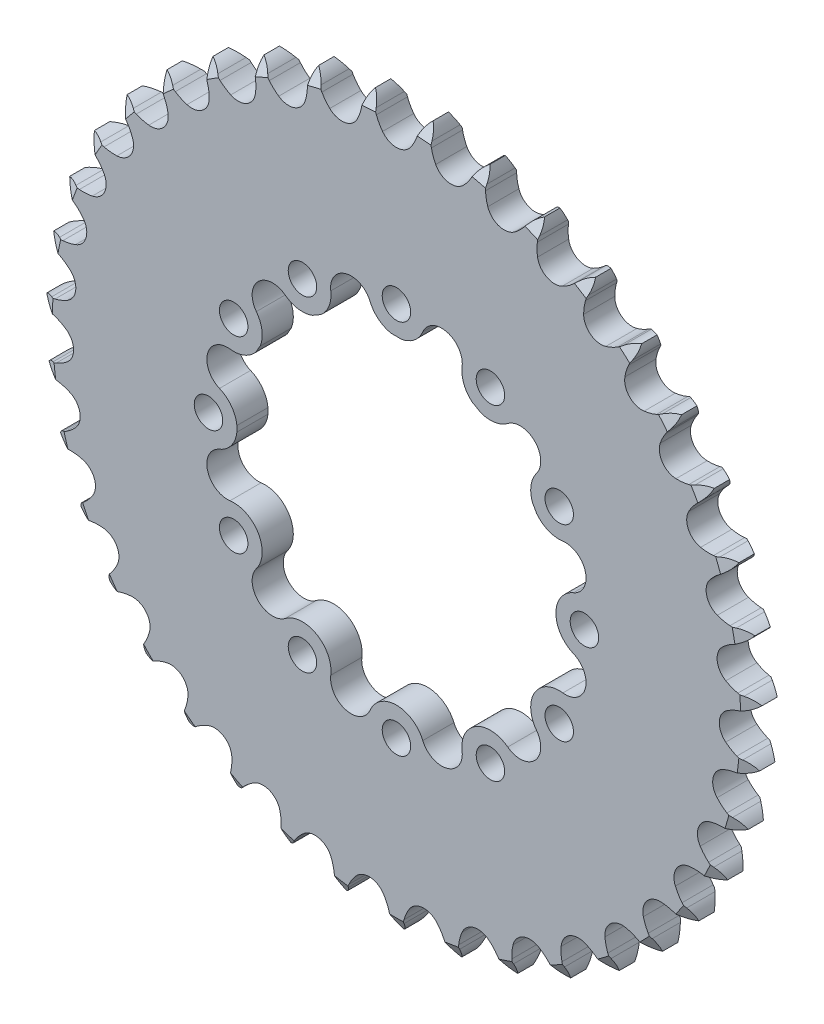
from build123d import *

# Parameters (mm, degrees)
EXTRUSION_DEPTH          = 7.2136
CIRPATTERN1_COUNT        = 12
CUT_EXTRUDE1_DEPTH       = 118.514389318
CUT_EXTRUDE1_DEPTH_BACK  = 118.514389318
SKETCH8_R                = 37
CENTER_CUTOUT_DEPTH      = 118.514389465
CENTER_CUTOUT_DEPTH_BACK = 118.514389465


with BuildPart() as part:
    # Teeth Sketch → Extrusion (new body)
    with BuildSketch(Plane.XY):
        with BuildLine():
            ThreePointArc((6.676484762, 82.703103732), (5.710873677, 81.555589606), (5.037571935, 80.215493266))
            Line((5.037571935, 80.215493266), (4.65053543, 79.150636707))
            ThreePointArc((4.65053543, 79.150636707), (4.030589042, 77.787636082), (3.22092759, 76.5280518))
            ThreePointArc((3.22092759, 76.5280518), (0, 74.905926143), (-3.22092759, 76.5280518))
            ThreePointArc((-3.22092759, 76.5280518), (-4.030589042, 77.787636082), (-4.65053543, 79.150636707))
            Line((-4.65053543, 79.150636707), (-5.037571935, 80.215493266))
            ThreePointArc((-5.037571935, 80.215493266), (-5.710873677, 81.555589606), (-6.676484762, 82.703103732))
            ThreePointArc((-6.676484762, 82.703103732), (-7.445517227, 81.415554702), (-7.895133318, 79.984807062))
            Line((-7.895133318, 79.984807062), (-8.106342797, 78.871655094))
            ThreePointArc((-8.106342797, 78.871655094), (-8.499620367, 77.426858575), (-9.096745387, 76.053706749))
            ThreePointArc((-9.096745387, 76.053706749), (-12.015755556, 73.935914073), (-15.455180235, 75.020360508))
            ThreePointArc((-15.455180235, 75.020360508), (-16.456408311, 76.133754674), (-17.286967233, 77.379658404))
            Line((-17.286967233, 77.379658404), (-17.83980672, 78.368640329))
            ThreePointArc((-17.83980672, 78.368640329), (-18.719355953, 79.583377579), (-19.856536839, 80.561136787))
            ThreePointArc((-19.856536839, 80.561136787), (-20.409073146, 79.166899696), (-20.623358765, 77.682556369))
            Line((-20.623358765, 77.682556369), (-20.653271004, 76.549939044))
            ThreePointArc((-20.653271004, 76.549939044), (-20.809694072, 75.060766102), (-21.178817437, 73.609610642))
            ThreePointArc((-21.178817437, 73.609610642), (-23.720309356, 71.051000665), (-27.289151829, 71.569681286))
            ThreePointArc((-27.289151829, 71.569681286), (-28.456015249, 72.508049011), (-29.475675664, 73.604587595))
            Line((-29.475675664, 73.604587595), (-30.179999883, 74.492080773))
            ThreePointArc((-30.179999883, 74.492080773), (-31.243016742, 75.549997876), (-32.522315041, 76.332678717))
            ThreePointArc((-32.522315041, 76.332678717), (-32.844044791, 74.867863573), (-32.817450053, 73.368368272))
            Line((-32.817450053, 73.368368272), (-32.66529034, 72.245619783))
            ThreePointArc((-32.66529034, 72.245619783), (-32.580807632, 70.750639215), (-32.71236924, 69.259064285))
            ThreePointArc((-32.71236924, 69.259064285), (-34.810519602, 66.325903661), (-38.416348726, 66.265384911))
            ThreePointArc((-38.416348726, 66.265384911), (-39.71862634, 67.004422965), (-40.900979579, 67.923196629))
            Line((-40.900979579, 67.923196629), (-41.738546902, 68.686215454))
            ThreePointArc((-41.738546902, 68.686215454), (-42.957499809, 69.559912912), (-44.345782367, 70.127244363))
            ThreePointArc((-44.345782367, 70.127244363), (-44.428372928, 68.629789109), (-44.161586623, 67.153977974))
            Line((-44.161586623, 67.153977974), (-43.831295815, 66.070176918))
            ThreePointArc((-43.831295815, 66.070176918), (-43.508095388, 64.608107935), (-43.398687863, 63.114744543))
            ThreePointArc((-43.398687863, 63.114744543), (-44.999155676, 59.883000591), (-48.54858237, 59.244849876))
            ThreePointArc((-48.54858237, 59.244849876), (-49.952545871, 59.765417561), (-51.266969607, 60.48263055))
            Line((-51.266969607, 60.48263055), (-52.21608748, 61.101413234))
            ThreePointArc((-52.21608748, 61.101413234), (-53.559406195, 61.768262742), (-55.020717224, 62.105551216))
            ThreePointArc((-55.020717224, 62.105551216), (-54.862029543, 60.614239157), (-54.361961296, 59.200334922))
            Line((-54.361961296, 59.200334922), (-53.862093752, 58.183551176))
            ThreePointArc((-53.862093752, 58.183551176), (-53.308546327, 56.792260597), (-52.961003266, 55.335786069))
            ThreePointArc((-52.961003266, 55.335786069), (-54.022337255, 51.889159262), (-57.423433231, 50.689904348))
            ThreePointArc((-57.423433231, 50.689904348), (-58.892720703, 50.978519235), (-60.305172051, 51.475596109))
            Line((-60.305172051, 51.475596109), (-61.34125882, 51.934116506))
            ThreePointArc((-61.34125882, 51.934116506), (-62.774152094, 52.376847013), (-64.270644405, 52.475356916))
            ThreePointArc((-64.270644405, 52.475356916), (-63.87478841, 51.02881225), (-63.154389727, 49.713434291))
            Line((-63.154389727, 49.713434291), (-62.497891753, 48.790002021))
            ThreePointArc((-62.497891753, 48.790002021), (-61.728333918, 47.505523541), (-61.151656504, 46.123659804))
            ThreePointArc((-61.151656504, 46.123659804), (-61.646368676, 42.551415963), (-64.811047336, 40.822116924))
            ThreePointArc((-64.811047336, 40.822116924), (-66.307605004, 40.871304038), (-67.781502216, 41.135370767))
            Line((-67.781502216, 41.135370767), (-68.877723777, 41.42175344))
            ThreePointArc((-68.877723777, 41.42175344), (-70.363080428, 41.628898458), (-71.855995657, 41.486078435))
            ThreePointArc((-71.855995657, 41.486078435), (-71.23322381, 40.12176591), (-70.311152637, 38.938981826))
            Line((-70.311152637, 38.938981826), (-69.515027187, 38.132817442))
            ThreePointArc((-69.515027187, 38.132817442), (-68.549390085, 36.988418379), (-67.75851396, 35.716954977))
            ThreePointArc((-67.75851396, 35.716954977), (-67.673791529, 32.111613343), (-70.520089358, 29.897058114))
            ThreePointArc((-70.520089358, 29.897058114), (-72.005157166, 29.705543536), (-73.502327078, 29.729760931))
            Line((-73.502327078, 29.729760931), (-74.630291869, 29.836588719))
            ThreePointArc((-74.630291869, 29.836588719), (-76.129641939, 29.8027833), (-77.580314364, 29.422332315))
            ThreePointArc((-77.580314364, 29.422332315), (-76.74675613, 28.175586908), (-75.646893627, 27.156030185))
            Line((-75.646893627, 27.156030185), (-74.731759931, 26.488012922))
            ThreePointArc((-74.731759931, 26.488012922), (-73.595053056, 25.51333261), (-72.610461496, 24.385199777))
            ThreePointArc((-72.610461496, 24.385199777), (-71.948498729, 20.840136804), (-74.402698108, 18.197681204))
            ThreePointArc((-74.402698108, 18.197681204), (-75.837813579, 17.77042506), (-77.319480277, 17.554165902))
            Line((-77.319480277, 17.554165902), (-78.449974603, 17.478672021))
            ThreePointArc((-78.449974603, 17.478672021), (-79.924485713, 17.204791709), (-81.295343681, 16.596563242))
            ThreePointArc((-81.295343681, 16.596563242), (-80.27258778, 15.499675005), (-79.023419807, 14.669751627))
            Line((-79.023419807, 14.669751627), (-78.012979347, 14.15718278))
            ThreePointArc((-78.012979347, 14.15718278), (-76.734642811, 13.377464928), (-75.58183622, 12.421880712))
            ThreePointArc((-75.58183622, 12.421880712), (-74.359777605, 9.028911669), (-76.358316059, 6.026993909))
            ThreePointArc((-76.358316059, 6.026993909), (-77.706310456, 5.375061909), (-79.134099551, 4.923927198))
            Line((-79.134099551, 4.923927198), (-80.237844202, 4.6680669))
            ThreePointArc((-80.237844202, 4.6680669), (-81.649327289, 4.161205049), (-82.904866299, 3.340951899))
            ThreePointArc((-82.904866299, 3.340951899), (-81.719401571, 2.422329661), (-80.353280924, 1.803534207))
            Line((-80.353280924, 1.803534207), (-79.273703577, 1.45968904))
            ThreePointArc((-79.273703577, 1.45968904), (-77.886845624, 0.895127931), (-76.595681088, 0.136841462))
            ThreePointArc((-76.595681088, 0.136841462), (-74.8451773, -3.016157536), (-76.336293733, -6.299789363))
            ThreePointArc((-76.336293733, -6.299789363), (-77.56225471, -7.159512522), (-78.899187214, -7.833838635))
            Line((-78.899187214, -7.833838635), (-79.947595784, -8.263438702))
            ThreePointArc((-79.947595784, -8.263438702), (-81.259494176, -8.990154635), (-82.367196428, -10.001188343))
            ThreePointArc((-82.367196428, -10.001188343), (-81.049725787, -10.717752749), (-79.602034272, -11.109393802))
            Line((-79.602034272, -11.109393802), (-78.481280524, -11.275609878))
            ThreePointArc((-78.481280524, -11.275609878), (-77.021820047, -11.610392409), (-75.625738049, -12.151741911))
            ThreePointArc((-75.625738049, -12.151741911), (-73.392126218, -14.983109845), (-74.337201497, -18.463411399))
            ThreePointArc((-74.337201497, -18.463411399), (-75.409377308, -19.50865934), (-76.620827372, -20.388712162))
            Line((-76.620827372, -20.388712162), (-77.586746629, -20.980925582))
            ThreePointArc((-77.586746629, -20.980925582), (-78.765082849, -21.908674036), (-79.696259435, -23.08430306))
            ThreePointArc((-79.696259435, -23.08430306), (-78.280904679, -23.580250992), (-76.789136745, -23.734594346))
            Line((-76.789136745, -23.734594346), (-75.656233531, -23.718876424))
            ThreePointArc((-75.656233531, -23.718876424), (-74.161969788, -23.815209685), (-72.697128119, -24.125601551))
            ThreePointArc((-72.697128119, -24.125601551), (-70.038257617, -26.562007479), (-70.41281479, -30.148840778))
            ThreePointArc((-70.41281479, -30.148840778), (-71.303436645, -31.352542128), (-72.358028349, -32.415528753))
            Line((-72.358028349, -32.415528753), (-73.216441492, -33.155017511))
            ThreePointArc((-73.216441492, -33.155017511), (-74.230697248, -34.259770288), (-74.961231185, -35.569546454))
            ThreePointArc((-74.961231185, -35.569546454), (-73.484649258, -35.832033121), (-71.987440912, -35.745081364))
            Line((-71.987440912, -35.745081364), (-70.871729829, -35.547836529))
            ThreePointArc((-70.871729829, -35.547836529), (-69.381363468, -35.403225539), (-67.885700756, -35.474620783))
            ThreePointArc((-67.885700756, -35.474620783), (-64.870434934, -37.452963072), (-64.664773166, -41.053431017))
            ThreePointArc((-64.664773166, -41.053431017), (-65.350774426, -42.384410543), (-66.221194398, -43.602800177))
            Line((-66.221194398, -43.602800177), (-66.949868978, -44.470411902))
            ThreePointArc((-66.949868978, -44.470411902), (-67.773775581, -45.723556485), (-68.284746423, -47.133557278))
            ThreePointArc((-68.284746423, -47.133557278), (-66.785180021, -47.155784414), (-65.321308173, -46.829789551))
            Line((-65.321308173, -46.829789551), (-64.251685552, -46.456126341))
            ThreePointArc((-64.251685552, -46.456126341), (-62.803816278, -46.074316448), (-61.316069403, -45.904865971))
            ThreePointArc((-61.316069403, -45.904865971), (-58.022502061, -47.373906594), (-57.241947884, -50.894758957))
            ThreePointArc((-57.241947884, -50.894758957), (-57.705561477, -52.318544989), (-58.369266298, -53.66078198))
            Line((-58.369266298, -53.66078198), (-58.949330025, -54.634045983))
            ThreePointArc((-58.949330025, -54.634045983), (-59.561548726, -56.003126587), (-59.839722596, -57.476833727))
            ThreePointArc((-59.839722596, -57.476833727), (-58.356009703, -57.25822566), (-56.963387864, -56.701630787))
            Line((-56.963387864, -56.701630787), (-55.967556369, -56.161226883))
            ThreePointArc((-55.967556369, -56.161226883), (-54.599683236, -55.552106762), (-53.15838406, -55.146199243))
            ThreePointArc((-53.15838406, -55.146199243), (-49.671816862, -56.06789082), (-48.336586219, -59.417939375))
            ThreePointArc((-48.336586219, -59.417939375), (-48.565804798, -60.897656602), (-49.00560486, -62.328977716))
            Line((-49.00560486, -62.328977716), (-49.422034389, -63.382686971))
            ThreePointArc((-49.422034389, -63.382686971), (-49.806709045, -64.832245127), (-49.844881387, -66.331490374))
            ThreePointArc((-49.844881387, -66.331490374), (-48.415449386, -65.877708938), (-47.130145731, -65.104929569))
            Line((-47.130145731, -65.104929569), (-46.233896874, -64.411781148))
            ThreePointArc((-46.233896874, -64.411781148), (-44.981447078, -63.591126692), (-43.623924493, -62.959274922))
            ThreePointArc((-43.623924493, -62.959274922), (-40.034657698, -63.309746125), (-38.179332362, -66.402226373))
            ThreePointArc((-38.179332362, -66.402226373), (-38.168219284, -67.899550896), (-38.372723998, -69.38288567))
            Line((-38.372723998, -69.38288567), (-38.614734022, -70.489749661))
            ThreePointArc((-38.614734022, -70.489749661), (-38.761901763, -71.982242573), (-38.559083932, -73.468196262))
            ThreePointArc((-38.559083932, -73.468196262), (-37.220954361, -72.790994159), (-36.076257579, -71.822044874))
            Line((-36.076257579, -71.822044874), (-35.302803736, -70.994104116))
            ThreePointArc((-35.302803736, -70.994104116), (-34.198215068, -69.983169844), (-32.959628196, -69.141738451))
            ThreePointArc((-32.959628196, -69.141738451), (-29.360621929, -68.91191226), (-27.033253851, -71.666730588))
            ThreePointArc((-27.033253851, -71.666730588), (-26.78209694, -73.142882488), (-26.74600974, -74.639813329))
            Line((-26.74600974, -74.639813329), (-26.807332328, -75.77116486))
            ThreePointArc((-26.807332328, -75.77116486), (-26.713181585, -77.267937748), (-26.274626458, -78.702114459))
            ThreePointArc((-26.274626458, -78.702114459), (-25.06245617, -77.819030866), (-24.088013307, -76.679006943))
            Line((-24.088013307, -76.679006943), (-23.457386525, -75.737717079))
            ThreePointArc((-23.457386525, -75.737717079), (-22.529267252, -74.562685657), (-21.441694841, -73.533467273))
            ThreePointArc((-21.441694841, -73.533467273), (-17.926161474, -72.729296065), (-15.187028265, -75.075104125))
            ThreePointArc((-15.187028265, -75.075104125), (-14.702332353, -76.491851845), (-14.426587879, -77.96360903))
            Line((-14.426587879, -77.96360903), (-14.305634807, -79.090146691))
            ThreePointArc((-14.305634807, -79.090146691), (-13.972604036, -80.552433921), (-13.309669959, -81.897689231))
            ThreePointArc((-13.309669959, -81.897689231), (-12.254853529, -80.83159555), (-11.475902142, -79.55002301))
            Line((-11.475902142, -79.55002301), (-11.004435324, -78.519762952))
            ThreePointArc((-11.004435324, -78.519762952), (-10.276823247, -77.211067077), (-9.368432854, -76.020717918))
            ThreePointArc((-9.368432854, -76.020717918), (-6.027422853, -74.663029306), (-2.947466624, -76.5390719))
            ThreePointArc((-2.947466624, -76.5390719), (-2.241785081, -77.859722417), (-1.733524971, -79.26818821))
            Line((-1.733524971, -79.26818821), (-1.43342886, -80.360735266))
            ThreePointArc((-1.43342886, -80.360735266), (-0.870143382, -81.750664368), (0, -82.97215687))
            ThreePointArc((0, -82.97215687), (0.870143382, -81.750664368), (1.43342886, -80.360735266))
            Line((1.43342886, -80.360735266), (1.733524971, -79.26818821))
            ThreePointArc((1.733524971, -79.26818821), (2.241785081, -77.859722417), (2.947466624, -76.5390719))
            ThreePointArc((2.947466624, -76.5390719), (6.027422853, -74.663029306), (9.368432854, -76.020717918))
            ThreePointArc((9.368432854, -76.020717918), (10.276823247, -77.211067077), (11.004435324, -78.519762952))
            Line((11.004435324, -78.519762952), (11.475902142, -79.55002301))
            ThreePointArc((11.475902142, -79.55002301), (12.254853529, -80.83159555), (13.309669959, -81.897689231))
            ThreePointArc((13.309669959, -81.897689231), (13.972604036, -80.552433921), (14.305634807, -79.090146691))
            Line((14.305634807, -79.090146691), (14.426587879, -77.96360903))
            ThreePointArc((14.426587879, -77.96360903), (14.702332353, -76.491851845), (15.187028265, -75.075104125))
            ThreePointArc((15.187028265, -75.075104125), (17.926161474, -72.729296065), (21.441694841, -73.533467273))
            ThreePointArc((21.441694841, -73.533467273), (22.529267252, -74.562685657), (23.457386525, -75.737717079))
            Line((23.457386525, -75.737717079), (24.088013307, -76.679006943))
            ThreePointArc((24.088013307, -76.679006943), (25.06245617, -77.819030866), (26.274626458, -78.702114459))
            ThreePointArc((26.274626458, -78.702114459), (26.713181585, -77.267937748), (26.807332328, -75.77116486))
            Line((26.807332328, -75.77116486), (26.74600974, -74.639813329))
            ThreePointArc((26.74600974, -74.639813329), (26.78209694, -73.142882488), (27.033253851, -71.666730588))
            ThreePointArc((27.033253851, -71.666730588), (29.360621929, -68.91191226), (32.959628196, -69.141738451))
            ThreePointArc((32.959628196, -69.141738451), (34.198215068, -69.983169844), (35.302803736, -70.994104116))
            Line((35.302803736, -70.994104116), (36.076257579, -71.822044874))
            ThreePointArc((36.076257579, -71.822044874), (37.220954361, -72.790994159), (38.559083932, -73.468196262))
            ThreePointArc((38.559083932, -73.468196262), (38.761901763, -71.982242573), (38.614734022, -70.489749661))
            Line((38.614734022, -70.489749661), (38.372723998, -69.38288567))
            ThreePointArc((38.372723998, -69.38288567), (38.168219284, -67.899550896), (38.179332362, -66.402226373))
            ThreePointArc((38.179332362, -66.402226373), (40.034657698, -63.309746125), (43.623924493, -62.959274922))
            ThreePointArc((43.623924493, -62.959274922), (44.981447078, -63.591126692), (46.233896874, -64.411781148))
            Line((46.233896874, -64.411781148), (47.130145731, -65.104929569))
            ThreePointArc((47.130145731, -65.104929569), (48.415449386, -65.877708938), (49.844881387, -66.331490374))
            ThreePointArc((49.844881387, -66.331490374), (49.806709045, -64.832245127), (49.422034389, -63.382686971))
            Line((49.422034389, -63.382686971), (49.00560486, -62.328977716))
            ThreePointArc((49.00560486, -62.328977716), (48.565804798, -60.897656602), (48.336586219, -59.417939375))
            ThreePointArc((48.336586219, -59.417939375), (49.671816862, -56.06789082), (53.15838406, -55.146199243))
            ThreePointArc((53.15838406, -55.146199243), (54.599683236, -55.552106762), (55.967556369, -56.161226883))
            Line((55.967556369, -56.161226883), (56.963387864, -56.701630787))
            ThreePointArc((56.963387864, -56.701630787), (58.356009703, -57.25822566), (59.839722596, -57.476833727))
            ThreePointArc((59.839722596, -57.476833727), (59.561548726, -56.003126587), (58.949330025, -54.634045983))
            Line((58.949330025, -54.634045983), (58.369266298, -53.66078198))
            ThreePointArc((58.369266298, -53.66078198), (57.705561477, -52.318544989), (57.241947884, -50.894758957))
            ThreePointArc((57.241947884, -50.894758957), (58.022502061, -47.373906594), (61.316069403, -45.904865971))
            ThreePointArc((61.316069403, -45.904865971), (62.803816278, -46.074316448), (64.251685552, -46.456126341))
            Line((64.251685552, -46.456126341), (65.321308173, -46.829789551))
            ThreePointArc((65.321308173, -46.829789551), (66.785180021, -47.155784414), (68.284746423, -47.133557278))
            ThreePointArc((68.284746423, -47.133557278), (67.773775581, -45.723556485), (66.949868978, -44.470411902))
            Line((66.949868978, -44.470411902), (66.221194398, -43.602800177))
            ThreePointArc((66.221194398, -43.602800177), (65.350774426, -42.384410543), (64.664773166, -41.053431017))
            ThreePointArc((64.664773166, -41.053431017), (64.870434934, -37.452963072), (67.885700756, -35.474620783))
            ThreePointArc((67.885700756, -35.474620783), (69.381363468, -35.403225539), (70.871729829, -35.547836529))
            Line((70.871729829, -35.547836529), (71.987440912, -35.745081364))
            ThreePointArc((71.987440912, -35.745081364), (73.484649258, -35.832033121), (74.961231185, -35.569546454))
            ThreePointArc((74.961231185, -35.569546454), (74.230697248, -34.259770288), (73.216441492, -33.155017511))
            Line((73.216441492, -33.155017511), (72.358028349, -32.415528753))
            ThreePointArc((72.358028349, -32.415528753), (71.303436645, -31.352542128), (70.41281479, -30.148840778))
            ThreePointArc((70.41281479, -30.148840778), (70.038257617, -26.562007479), (72.697128119, -24.125601551))
            ThreePointArc((72.697128119, -24.125601551), (74.161969788, -23.815209685), (75.656233531, -23.718876424))
            Line((75.656233531, -23.718876424), (76.789136745, -23.734594346))
            ThreePointArc((76.789136745, -23.734594346), (78.280904679, -23.580250992), (79.696259435, -23.08430306))
            ThreePointArc((79.696259435, -23.08430306), (78.765082849, -21.908674036), (77.586746629, -20.980925582))
            Line((77.586746629, -20.980925582), (76.620827372, -20.388712162))
            ThreePointArc((76.620827372, -20.388712162), (75.409377308, -19.50865934), (74.337201497, -18.463411399))
            ThreePointArc((74.337201497, -18.463411399), (73.392126218, -14.983109845), (75.625738049, -12.151741911))
            ThreePointArc((75.625738049, -12.151741911), (77.021820047, -11.610392409), (78.481280524, -11.275609878))
            Line((78.481280524, -11.275609878), (79.602034272, -11.109393802))
            ThreePointArc((79.602034272, -11.109393802), (81.049725787, -10.717752749), (82.367196428, -10.001188343))
            ThreePointArc((82.367196428, -10.001188343), (81.259494176, -8.990154635), (79.947595784, -8.263438702))
            Line((79.947595784, -8.263438702), (78.899187214, -7.833838635))
            ThreePointArc((78.899187214, -7.833838635), (77.56225471, -7.159512522), (76.336293733, -6.299789363))
            ThreePointArc((76.336293733, -6.299789363), (74.8451773, -3.016157536), (76.595681088, 0.136841462))
            ThreePointArc((76.595681088, 0.136841462), (77.886845624, 0.895127931), (79.273703577, 1.45968904))
            Line((79.273703577, 1.45968904), (80.353280924, 1.803534207))
            ThreePointArc((80.353280924, 1.803534207), (81.719401571, 2.422329661), (82.904866299, 3.340951899))
            ThreePointArc((82.904866299, 3.340951899), (81.649327289, 4.161205049), (80.237844202, 4.6680669))
            Line((80.237844202, 4.6680669), (79.134099551, 4.923927198))
            ThreePointArc((79.134099551, 4.923927198), (77.706310456, 5.375061909), (76.358316059, 6.026993909))
            ThreePointArc((76.358316059, 6.026993909), (74.359777605, 9.028911669), (75.58183622, 12.421880712))
            ThreePointArc((75.58183622, 12.421880712), (76.734642811, 13.377464928), (78.012979347, 14.15718278))
            Line((78.012979347, 14.15718278), (79.023419807, 14.669751627))
            ThreePointArc((79.023419807, 14.669751627), (80.27258778, 15.499675005), (81.295343681, 16.596563242))
            ThreePointArc((81.295343681, 16.596563242), (79.924485713, 17.204791709), (78.449974603, 17.478672021))
            Line((78.449974603, 17.478672021), (77.319480277, 17.554165902))
            ThreePointArc((77.319480277, 17.554165902), (75.837813579, 17.77042506), (74.402698108, 18.197681204))
            ThreePointArc((74.402698108, 18.197681204), (71.948498729, 20.840136804), (72.610461496, 24.385199777))
            ThreePointArc((72.610461496, 24.385199777), (73.595053056, 25.51333261), (74.731759931, 26.488012922))
            Line((74.731759931, 26.488012922), (75.646893627, 27.156030185))
            ThreePointArc((75.646893627, 27.156030185), (76.74675613, 28.175586908), (77.580314364, 29.422332315))
            ThreePointArc((77.580314364, 29.422332315), (76.129641939, 29.8027833), (74.630291869, 29.836588719))
            Line((74.630291869, 29.836588719), (73.502327078, 29.729760931))
            ThreePointArc((73.502327078, 29.729760931), (72.005157166, 29.705543536), (70.520089358, 29.897058114))
            ThreePointArc((70.520089358, 29.897058114), (67.673791529, 32.111613343), (67.75851396, 35.716954977))
            ThreePointArc((67.75851396, 35.716954977), (68.549390085, 36.988418379), (69.515027187, 38.132817442))
            Line((69.515027187, 38.132817442), (70.311152637, 38.938981826))
            ThreePointArc((70.311152637, 38.938981826), (71.23322381, 40.12176591), (71.855995657, 41.486078435))
            ThreePointArc((71.855995657, 41.486078435), (70.363080428, 41.628898458), (68.877723777, 41.42175344))
            Line((68.877723777, 41.42175344), (67.781502216, 41.135370767))
            ThreePointArc((67.781502216, 41.135370767), (66.307605004, 40.871304038), (64.811047336, 40.822116924))
            ThreePointArc((64.811047336, 40.822116924), (61.646368676, 42.551415963), (61.151656504, 46.123659804))
            ThreePointArc((61.151656504, 46.123659804), (61.728333918, 47.505523541), (62.497891753, 48.790002021))
            Line((62.497891753, 48.790002021), (63.154389727, 49.713434291))
            ThreePointArc((63.154389727, 49.713434291), (63.87478841, 51.02881225), (64.270644405, 52.475356916))
            ThreePointArc((64.270644405, 52.475356916), (62.774152094, 52.376847013), (61.34125882, 51.934116506))
            Line((61.34125882, 51.934116506), (60.305172051, 51.475596109))
            ThreePointArc((60.305172051, 51.475596109), (58.892720703, 50.978519235), (57.423433231, 50.689904348))
            ThreePointArc((57.423433231, 50.689904348), (54.022337255, 51.889159262), (52.961003266, 55.335786069))
            ThreePointArc((52.961003266, 55.335786069), (53.308546327, 56.792260597), (53.862093752, 58.183551176))
            Line((53.862093752, 58.183551176), (54.361961296, 59.200334922))
            ThreePointArc((54.361961296, 59.200334922), (54.862029543, 60.614239157), (55.020717224, 62.105551216))
            ThreePointArc((55.020717224, 62.105551216), (53.559406195, 61.768262742), (52.21608748, 61.101413234))
            Line((52.21608748, 61.101413234), (51.266969607, 60.48263055))
            ThreePointArc((51.266969607, 60.48263055), (49.952545871, 59.765417561), (48.54858237, 59.244849876))
            ThreePointArc((48.54858237, 59.244849876), (44.999155676, 59.883000591), (43.398687863, 63.114744543))
            ThreePointArc((43.398687863, 63.114744543), (43.508095388, 64.608107935), (43.831295815, 66.070176918))
            Line((43.831295815, 66.070176918), (44.161586623, 67.153977974))
            ThreePointArc((44.161586623, 67.153977974), (44.428372928, 68.629789109), (44.345782367, 70.127244363))
            ThreePointArc((44.345782367, 70.127244363), (42.957499809, 69.559912912), (41.738546902, 68.686215454))
            Line((41.738546902, 68.686215454), (40.900979579, 67.923196629))
            ThreePointArc((40.900979579, 67.923196629), (39.71862634, 67.004422965), (38.416348726, 66.265384911))
            ThreePointArc((38.416348726, 66.265384911), (34.810519602, 66.325903661), (32.71236924, 69.259064285))
            ThreePointArc((32.71236924, 69.259064285), (32.580807632, 70.750639215), (32.66529034, 72.245619783))
            Line((32.66529034, 72.245619783), (32.817450053, 73.368368272))
            ThreePointArc((32.817450053, 73.368368272), (32.844044791, 74.867863573), (32.522315041, 76.332678717))
            ThreePointArc((32.522315041, 76.332678717), (31.243016742, 75.549997876), (30.179999883, 74.492080773))
            Line((30.179999883, 74.492080773), (29.475675664, 73.604587595))
            ThreePointArc((29.475675664, 73.604587595), (28.456015249, 72.508049011), (27.289151829, 71.569681286))
            ThreePointArc((27.289151829, 71.569681286), (23.720309356, 71.051000665), (21.178817437, 73.609610642))
            ThreePointArc((21.178817437, 73.609610642), (20.809694072, 75.060766102), (20.653271004, 76.549939044))
            Line((20.653271004, 76.549939044), (20.623358765, 77.682556369))
            ThreePointArc((20.623358765, 77.682556369), (20.409073146, 79.166899696), (19.856536839, 80.561136787))
            ThreePointArc((19.856536839, 80.561136787), (18.719355953, 79.583377579), (17.83980672, 78.368640329))
            Line((17.83980672, 78.368640329), (17.286967233, 77.379658404))
            ThreePointArc((17.286967233, 77.379658404), (16.456408311, 76.133754674), (15.455180235, 75.020360508))
            ThreePointArc((15.455180235, 75.020360508), (12.015755556, 73.935914073), (9.096745387, 76.053706749))
            ThreePointArc((9.096745387, 76.053706749), (8.499620367, 77.426858575), (8.106342797, 78.871655094))
            Line((8.106342797, 78.871655094), (7.895133318, 79.984807062))
            ThreePointArc((7.895133318, 79.984807062), (7.445517227, 81.415554702), (6.676484762, 82.703103732))
        make_face()
    extrude(amount=EXTRUSION_DEPTH)

    # Sketch7 → M6 Clearance Hole1 (revolve, cut)
    with BuildSketch(Plane(origin=(0, 43.500000122, 0), x_dir=(0, 1, 0), z_dir=(1, 0, 0))):
        Polygon((0, 0), (0, 19.254840043), (3.3, 17.272), (3.3, 0), align=None)
    m6_clearance_hole1 = revolve(axis=Axis((0, 43.500000122, -6.35), (0, 0, 1)), mode=Mode.SUBTRACT)

    # CirPattern1: M6 Clearance Hole1 ×12 about axis
    cirpattern1_axis = Axis((0, -0.078817912, 0), (0, 0, 1))
    for i in range(1, CIRPATTERN1_COUNT):
        add(m6_clearance_hole1.rotate(cirpattern1_axis, i * 360 / CIRPATTERN1_COUNT), mode=Mode.SUBTRACT)

    # Sketch8 → Cut-Extrude1 (cut, two sides: drawn at the far end of the back side and taken through both)
    with BuildSketch(Plane(origin=(0, 0, 0), x_dir=(-1, 0, 0), z_dir=(0, 0, -1)).offset(-CUT_EXTRUDE1_DEPTH_BACK)):
        Circle(SKETCH8_R)
    extrude(amount=CUT_EXTRUDE1_DEPTH + CUT_EXTRUDE1_DEPTH_BACK, mode=Mode.SUBTRACT)

    # Sketch5 → Cut-Revolve1 (revolve, cut)
    with BuildSketch(Plane(origin=(0, 0, 0), x_dir=(0, 0, -1), z_dir=(1, 0, 0))):
        Polygon((-7.2136, -79.778574738), (-7.2136, -82.97215687), (-5.3848, -82.97215687), align=None)
    cut_revolve1 = revolve(axis=Axis((0, 0, 7.2136), (0, 0, -1)), mode=Mode.SUBTRACT)

    # Mirror1: Cut-Revolve1 across plane
    add(cut_revolve1.mirror(Plane.XY.offset(3.6068)), mode=Mode.SUBTRACT)

    # Sketch9 → Center Cutout (cut, two sides: drawn at the far end of the back side and taken through both)
    with BuildSketch(Plane.XY.offset(7.2136).offset(-CENTER_CUTOUT_DEPTH_BACK)):
        with BuildLine():
            ThreePointArc((1.148678559, 36.982165128), (0, 36.881719723), (-1.148678559, 36.982165128))
            ThreePointArc((-1.148678559, 36.982165128), (-9.617726785, 35.728130814), (-17.571834052, 32.561183149))
            ThreePointArc((-17.571834052, 32.561183149), (-18.475078878, 31.932946165), (-19.469920872, 31.463028799))
            ThreePointArc((-19.469920872, 31.463028799), (-22.757183287, 31.114405097), (-25.803005362, 32.399162099))
            ThreePointArc((-25.803005362, 32.399162099), (-32.058776499, 31.979958587), (-32.477980012, 25.72418745))
            ThreePointArc((-32.477980012, 25.72418745), (-31.470213373, 23.82881041), (-31.122083086, 21.710591105))
            ThreePointArc((-31.122083086, 21.710591105), (-31.241007029, 20.461591061), (-31.59350497, 19.257477605))
            ThreePointArc((-31.59350497, 19.257477605), (-32.00358372, 18.410440597), (-32.529655862, 17.630130162))
            ThreePointArc((-32.529655862, 17.630130162), (-35.22884515, 15.587363925), (-38.585048144, 15.14643516))
            ThreePointArc((-38.585048144, 15.14643516), (-43.793103112, 11.655508701), (-41.028258435, 6.02825022))
            ThreePointArc((-41.028258435, 6.02825022), (-38.265449818, 3.867034802), (-36.99517654, 0.597421776))
            ThreePointArc((-36.99517654, 0.597421776), (-36.969203034, 0.259745217), (-36.960537635, -0.078817912))
            ThreePointArc((-36.960537635, -0.078817912), (-36.968601511, -0.405426166), (-36.992773486, -0.731238524))
            ThreePointArc((-36.992773486, -0.731238524), (-38.258321936, -4.015054276), (-41.028258435, -6.185886044))
            ThreePointArc((-41.028258435, -6.185886044), (-43.793103112, -11.813144525), (-38.585048144, -15.304070984))
            ThreePointArc((-38.585048144, -15.304070984), (-33.369363855, -16.898720145), (-31.122083086, -21.868226929))
            ThreePointArc((-31.122083086, -21.868226929), (-31.470213373, -23.986446234), (-32.477980012, -25.881823274))
            ThreePointArc((-32.477980012, -25.881823274), (-32.058776499, -32.137594411), (-25.803005362, -32.556797924))
            ThreePointArc((-25.803005362, -32.556797924), (-18.853550589, -31.887708499), (-15.171128618, -37.819181396))
            ThreePointArc((-15.171128618, -37.819181396), (-15.184673592, -38.242389865), (-15.225253072, -38.663866056))
            ThreePointArc((-15.225253072, -38.663866056), (-11.734326613, -43.871921024), (-6.107068132, -41.107076347))
            ThreePointArc((-6.107068132, -41.107076347), (0, -37.039355547), (6.107068132, -41.107076347))
            ThreePointArc((6.107068132, -41.107076347), (11.734326613, -43.871921024), (15.225253072, -38.663866056))
            ThreePointArc((15.225253072, -38.663866056), (18.480268818, -32.087582442), (25.803005362, -32.556797924))
            ThreePointArc((25.803005362, -32.556797924), (32.058776499, -32.137594411), (32.477980012, -25.881823274))
            ThreePointArc((32.477980012, -25.881823274), (31.135298942, -22.286267386), (32.013950026, -18.550121394))
            ThreePointArc((32.013950026, -18.550121394), (35.635096733, -9.956901166), (36.992773486, -0.731238524))
            ThreePointArc((36.992773486, -0.731238524), (36.96054846, -0.066847918), (36.99517654, 0.597421776))
            ThreePointArc((36.99517654, 0.597421776), (35.79041588, 9.383289996), (32.529655862, 17.630130162))
            ThreePointArc((32.529655862, 17.630130162), (32.00358372, 18.410440597), (31.59350497, 19.257477605))
            ThreePointArc((31.59350497, 19.257477605), (31.183132, 22.607447115), (32.477980012, 25.72418745))
            ThreePointArc((32.477980012, 25.72418745), (32.058776499, 31.979958587), (25.803005362, 32.399162099))
            ThreePointArc((25.803005362, 32.399162099), (22.757183287, 31.114405097), (19.469920872, 31.463028799))
            ThreePointArc((19.469920872, 31.463028799), (18.475078878, 31.932946165), (17.571834052, 32.561183149))
            ThreePointArc((17.571834052, 32.561183149), (9.617726785, 35.728130814), (1.148678559, 36.982165128))
        make_face()
        with BuildLine():
            ThreePointArc((41.028258435, -6.185886044), (38.258321936, -4.015054276), (36.992773486, -0.731238524))
            ThreePointArc((36.992773486, -0.731238524), (35.635096733, -9.956901166), (32.013950026, -18.550121394))
            ThreePointArc((32.013950026, -18.550121394), (34.809147042, -15.934458682), (38.585048144, -15.304070984))
            ThreePointArc((38.585048144, -15.304070984), (43.793103112, -11.813144525), (41.028258435, -6.185886044))
        make_face()
        with BuildLine():
            ThreePointArc((41.028258435, 6.02825022), (43.793103112, 11.655508701), (38.585048144, 15.14643516))
            ThreePointArc((38.585048144, 15.14643516), (35.22884515, 15.587363925), (32.529655862, 17.630130162))
            ThreePointArc((32.529655862, 17.630130162), (35.79041588, 9.383289996), (36.99517654, 0.597421776))
            ThreePointArc((36.99517654, 0.597421776), (38.265449818, 3.867034802), (41.028258435, 6.02825022))
        make_face()
        with BuildLine():
            ThreePointArc((-1.148678559, 36.982165128), (-4.134765232, 38.332278002), (-6.107068132, 40.949440523))
            ThreePointArc((-6.107068132, 40.949440523), (-11.734326613, 43.7142852), (-15.225253072, 38.506230231))
            ThreePointArc((-15.225253072, 38.506230231), (-15.184673592, 38.08475404), (-15.171128618, 37.661545572))
            ThreePointArc((-15.171128618, 37.661545572), (-15.801307099, 34.842987278), (-17.571834052, 32.561183149))
            ThreePointArc((-17.571834052, 32.561183149), (-9.617726785, 35.728130814), (-1.148678559, 36.982165128))
        make_face()
        with BuildLine():
            ThreePointArc((15.225253072, 38.506230231), (11.734326613, 43.7142852), (6.107068132, 40.949440523))
            ThreePointArc((6.107068132, 40.949440523), (4.134765232, 38.332278002), (1.148678559, 36.982165128))
            ThreePointArc((1.148678559, 36.982165128), (9.617726785, 35.728130814), (17.571834052, 32.561183149))
            ThreePointArc((17.571834052, 32.561183149), (15.633328563, 35.231667205), (15.225253072, 38.506230231))
        make_face()
    extrude(amount=CENTER_CUTOUT_DEPTH + CENTER_CUTOUT_DEPTH_BACK, mode=Mode.SUBTRACT)


solid = part.part
